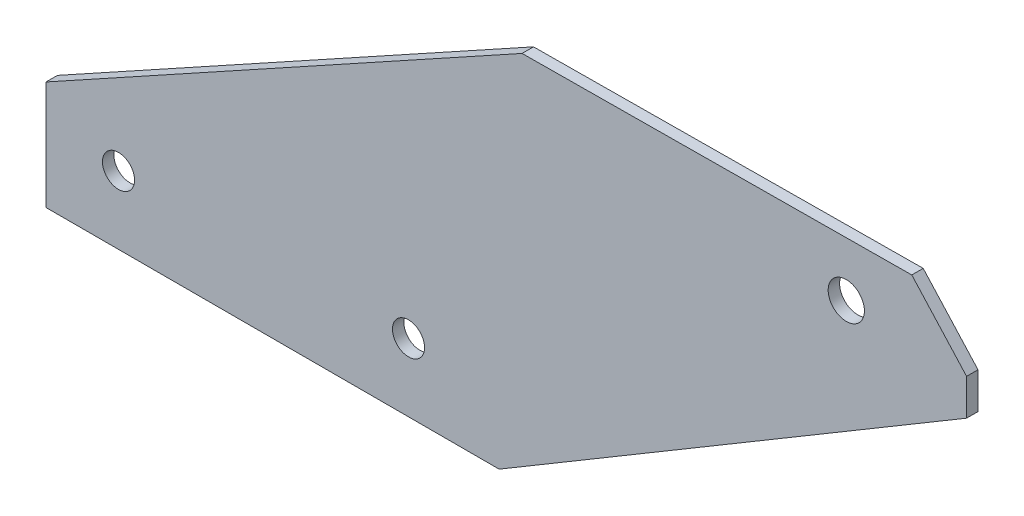
from build123d import *

# Parameters (mm, degrees)
SKETCH1_R           = 2.2479
SKETCH1_R_2         = 2.54
BOSS_EXTRUDE1_DEPTH = 1.6002


with BuildPart() as part:
    # Sketch1 → Boss-Extrude1 (new body)
    with BuildSketch(Plane.XY):
        Polygon((0, 0), (0, 15.24), (66.713584346, 52.060343069), (121.323584346, 52.482745441), (129.001606936, 44.01558127), (129.001606936, 38.93558127), (63.5, 0), align=None)
        with Locations((10.16, 9.525)):
            Circle(SKETCH1_R, mode=Mode.SUBTRACT)
        with Locations((50.8, 9.525)):
            Circle(SKETCH1_R, mode=Mode.SUBTRACT)
        with Locations((112.144430617, 44.791517748)):
            Circle(SKETCH1_R_2, mode=Mode.SUBTRACT)
    extrude(amount=-BOSS_EXTRUDE1_DEPTH)


solid = part.part
